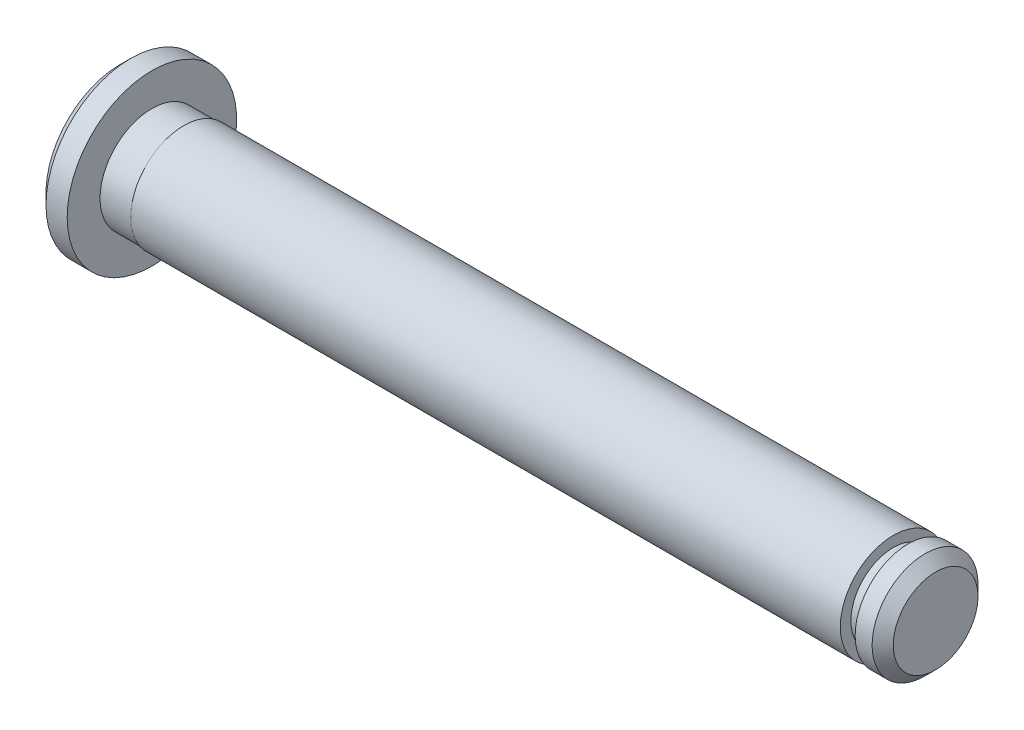
from build123d import *

# Parameters (mm, degrees)
CHAMFER1_SIZE = 0.5


with BuildPart() as part:
    # Sketch1 → Revolve1 (revolve)
    with BuildSketch(Plane.XY):
        Polygon((-1.5, 0), (-1.5, 4), (0, 4), (0, 2.45), (1.5, 2.45), (1.5, 2.5), (35, 2.5), (35, 2), (35.7, 2), (35.7, 2.5), (37, 2.5), (37, 0), align=None)
    revolve(axis=Axis((0, 0, 0), (1, 0, 0)))

    # Chamfer1
    chamfer1_edges = [part.edges().sort_by_distance(p)[0] for p in [
        (-1.5, -4, 0),
        (37, -2.5, 0),
    ]]
    chamfer(chamfer1_edges, length=CHAMFER1_SIZE)


solid = part.part
